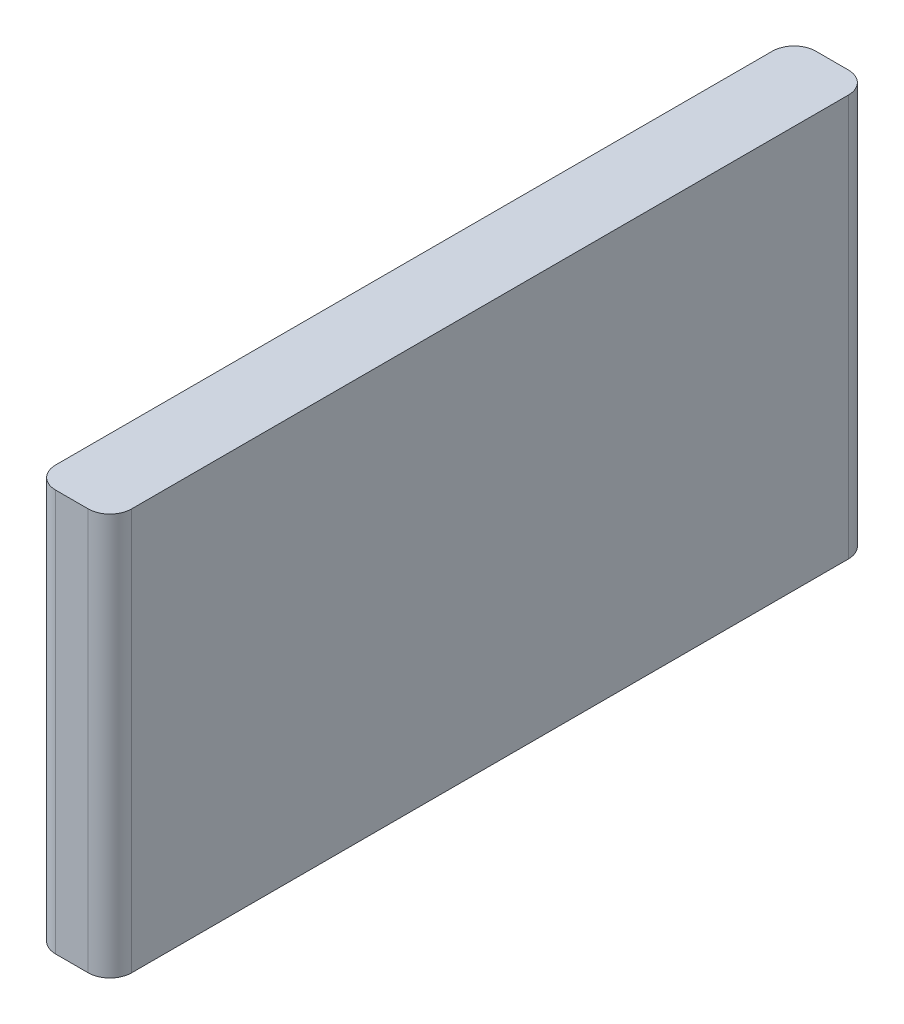
from build123d import *

# Parameters (mm, degrees)
SKETCH1_W           = 70
SKETCH1_H           = 37
BOSS_EXTRUDE1_DEPTH = 7
FILLET1_R           = 2


with BuildPart() as part:
    # Sketch1 → Boss-Extrude1 (new body)
    with BuildSketch(Plane(origin=(0, 0, 0), x_dir=(0, 0, -1), z_dir=(1, 0, 0))):
        with Locations((35, 18.5)):
            Rectangle(SKETCH1_W, SKETCH1_H)
    extrude(amount=BOSS_EXTRUDE1_DEPTH)

    # Fillet1
    fillet1_edges = [part.edges().sort_by_distance(p)[0] for p in [
        (0, 18.5, 0),
        (7, 18.5, 0),
        (7, 18.5, -70),
        (0, 18.5, -70),
    ]]
    fillet(fillet1_edges, radius=FILLET1_R)


solid = part.part
